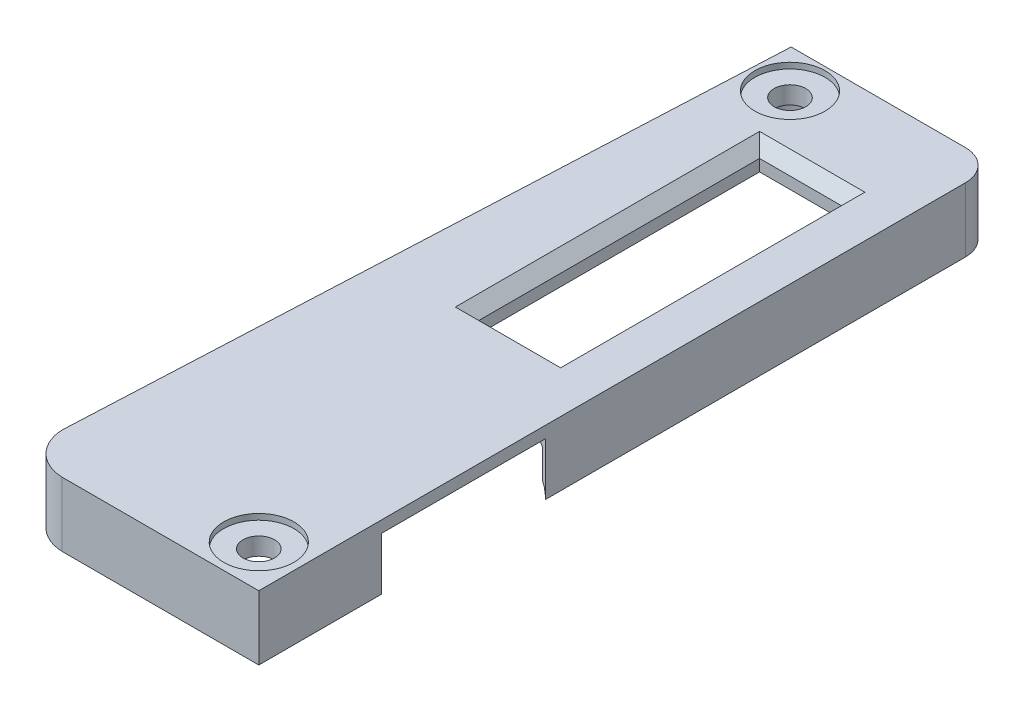
from build123d import *

# Parameters (mm, degrees)
SKETCH_1_R               = 1.35
EXTRUDE_1_DEPTH          = 2
EXTRUDE_2_DEPTH          = 2
CUT_EXTRUDE_1_DEPTH      = 62.421331799
CUT_EXTRUDE_1_DEPTH_BACK = 62.421331799
EXTRUDE_START            = 3.5
EXTRUDE_3_DEPTH          = 3.5
SKETCH_5_W               = 14
SKETCH_5_H               = 4.5
CUT_EXTRUDE_2_DEPTH      = 9
CUT_EXTRUDE_3_REACH      = 63.635
SKETCH_7_W               = 7
SKETCH_7_H               = 24
CUT_EXTRUDE_4_DEPTH      = 62.488454201
CHAMFER_1_SIZE           = 1
EXTRUDE_4_DEPTH          = 3
EXTRUDE_START_2          = 3
EXTRUDE_5_DEPTH          = 3
CHAMFER_2_SIZE           = 1.5
EXTRUDE_6_DEPTH          = 1
EXTRUDE_START_3          = 1
EXTRUDE_7_DEPTH          = 1
SKETCH_12_R              = 3
CUT_EXTRUDE_5_DEPTH      = 0.5


with BuildPart() as part:
    # 草图1 → 凸台-拉伸1 (new body)
    with BuildSketch(Plane(origin=(0, 0, 0), x_dir=(1, 0, 0), z_dir=(0, 1, 0))):
        with BuildLine():
            Line((0, 3.3), (11.7, 3.3))
            ThreePointArc((11.7, 3.3), (13.538477631, 2.538477631), (14.3, 0.7))
            Line((14.3, 0.7), (14.3, -59.7))
            Line((14.3, -59.7), (-3.3, -59.7))
            Line((-3.3, -59.7), (-3.3, 0))
            Line((-3.3, 0), (-3.3, 3.3))
            Line((-3.3, 3.3), (0, 3.3))
        make_face()
        with Locations(Location((0, 0, 0), (0, 0, 270))):
            Circle(SKETCH_1_R, mode=Mode.SUBTRACT)
        with Locations(Location((10.7, -56.1, 0), (0, 0, 270))):
            Circle(SKETCH_1_R, mode=Mode.SUBTRACT)
    extrude(amount=EXTRUDE_1_DEPTH)

    # 草图2 → 凸台-拉伸2 (add)
    with BuildSketch(Plane(origin=(0, 2, 0), x_dir=(1, 0, 0), z_dir=(0, 1, 0))):
        Polygon((-3.3, 1.179910787), (-6.171573065, -59.7), (-3.3, -59.7), align=None)
    extrude(amount=-EXTRUDE_2_DEPTH)

    # 草图3 → 切除-拉伸1 (cut, two sides: drawn at the far end of the back side and taken through both)
    with BuildSketch(Plane(origin=(0, 2, 0), x_dir=(1, 0, 0), z_dir=(0, 1, 0)).offset(-CUT_EXTRUDE_1_DEPTH_BACK)):
        Polygon((-3.3, 3.3), (-3.3, 1.179910787), (-3.2, 3.3), align=None)
        with BuildLine():
            ThreePointArc((-2.499988961, -59.7), (-4.984483511, -58.608076588), (-6.001389, -56.091946))
            Line((-6.001389, -56.091946), (-6.171573065, -59.7))
            Line((-6.171573065, -59.7), (-2.499988961, -59.7))
        make_face()
    extrude(amount=CUT_EXTRUDE_1_DEPTH + CUT_EXTRUDE_1_DEPTH_BACK, mode=Mode.SUBTRACT)

    # 草图4 → 凸台-拉伸3 (add)
    with BuildSketch(Plane.XZ.offset(EXTRUDE_START)):
        with BuildLine():
            Line((-6.001389, 56.091946), (-3.2, -3.3))
            Line((-3.2, -3.3), (11.7, -3.3))
            ThreePointArc((11.7, -3.3), (13.538477631, -2.538477631), (14.3, -0.7))
            Line((14.3, -0.7), (14.3, 59.7))
            Line((14.3, 59.7), (-2.499988961, 59.7))
            ThreePointArc((-2.499988961, 59.7), (-4.984483511, 58.608076588), (-6.001389, 56.091946))
        make_face()
        with BuildLine():
            Line((12.8, -0.7), (12.8, 54.32447191))
            ThreePointArc((12.8, 54.32447191), (12.644543648, 58.044543648), (8.92447191, 58.2))
            Line((8.92447191, 58.2), (-2.476371899, 58.2))
            ThreePointArc((-2.476371899, 58.2), (-3.904150356, 57.567435732), (-4.501255338, 56.124468472))
            Line((-4.501255338, 56.124468472), (-1.945653662, 1.943433001))
            ThreePointArc((-1.945653662, 1.943433001), (-1.872904729, -2.013635488), (2.079062289, -1.8))
            Line((2.079062289, -1.8), (11.7, -1.8))
            ThreePointArc((11.7, -1.8), (12.477817459, -1.477817459), (12.8, -0.7))
        make_face(mode=Mode.SUBTRACT)
    extrude(amount=-EXTRUDE_3_DEPTH)

    # 草图5 → 切除-拉伸2 (cut)
    with BuildSketch(Plane(origin=(14.3, 0, 0), x_dir=(0, 0, -1), z_dir=(1, 0, 0))):
        with Locations((-42.2, -1.25)):
            Rectangle(SKETCH_5_W, SKETCH_5_H)
    extrude(amount=-CUT_EXTRUDE_2_DEPTH, mode=Mode.SUBTRACT)

    # 切除-拉伸3: up to this face of the body (flat: up to its plane)
    cut_extrude_3_end = Plane(part.part.faces().sort_by_distance((9.8, 1, 42.2))[0])
    # 草图6 → 切除-拉伸3 (cut, up to the picked face)
    with BuildSketch(Plane.XZ.offset(3.5), mode=Mode.PRIVATE) as cut_extrude_3_sk1:
        with BuildLine():
            Line((2.158571571, 33.539745962), (2.158571571, 50.860254038))
            ThreePointArc((2.158571571, 50.860254038), (17.158571571, 42.2), (2.158571571, 33.539745962))
        make_face()
    cut_extrude_3_tool1 = split(extrude(cut_extrude_3_sk1.sketch, amount=-CUT_EXTRUDE_3_REACH, mode=Mode.PRIVATE), bisect_by=cut_extrude_3_end, keep=Keep.BOTH, mode=Mode.PRIVATE)
    add(cut_extrude_3_tool1.solids().sort_by(Axis((8.87184, -3.5, 42.2), (0, 1, 0)))[0], mode=Mode.SUBTRACT)

    # 草图7 → 切除-拉伸4 (cut, through all)
    with BuildSketch(Plane.XZ):
        with Locations((6.2, 17.3)):
            Rectangle(SKETCH_7_W, SKETCH_7_H)
    extrude(amount=-CUT_EXTRUDE_4_DEPTH, mode=Mode.SUBTRACT)

    # 倒角1
    chamfer_1_edges = [part.edges().sort_by_distance(p)[0] for p in [
        (2.7, 2, 17.3),
        (6.2, 2, 29.3),
        (9.7, 2, 17.3),
        (6.2, 2, 5.3),
    ]]
    chamfer(chamfer_1_edges, length=CHAMFER_1_SIZE)

    # 草图8 → 凸台-拉伸4 (add)
    with BuildSketch(Plane.XZ):
        Polygon((-2.891678333, 22), (0.3, 22), (0.3, 18), (-2.703007027, 18), align=None)
        Polygon((-2.514335721, 14), (0.3, 14), (0.3, 10), (-2.325664416, 10), align=None)
    extrude(amount=EXTRUDE_4_DEPTH)

    # 草图9 → 凸台-拉伸5 (add)
    with BuildSketch(Plane.XZ.offset(EXTRUDE_START_2)):
        with BuildLine():
            Line((2.75, 0), (2.75, 2.6))
            Line((2.75, 2.6), (3.3, 2.6))
            Line((3.3, 2.6), (3.3, -1.8))
            Line((3.3, -1.8), (2.079062289, -1.8))
            ThreePointArc((2.079062289, -1.8), (2.576812109, -0.960489122), (2.75, 0))
        make_face()
    extrude(amount=-EXTRUDE_5_DEPTH)

    # 倒角2
    chamfer_2_edges = [part.edges().sort_by_distance(p)[0] for p in [
        (0.3, -3, 20),
        (0.3, -3, 12),
        (3.025, -3, 2.6),
    ]]
    chamfer(chamfer_2_edges, length=CHAMFER_2_SIZE)

    # 草图10 → 凸台-拉伸6 (add)
    with BuildSketch(Plane.XZ):
        Polygon((0.3, 22), (0.3, 31.6), (-3.344489466, 31.6), (-2.891678333, 22), align=None)
        Polygon((0.3, 18), (0.3, 14), (-2.514335721, 14), (-2.703007027, 18), align=None)
    extrude(amount=EXTRUDE_6_DEPTH)

    # 草图11 → 凸台-拉伸7 (add)
    with BuildSketch(Plane.XZ.offset(EXTRUDE_START_3)):
        with BuildLine():
            Line((0.3, 31.6), (12.8, 31.6))
            Line((12.8, 31.6), (12.8, 33.943227914))
            ThreePointArc((12.8, 33.943227914), (7.537460775, 32.207180429), (2.158571571, 33.539745962))
            Line((2.158571571, 33.539745962), (2.158571571, 33.6))
            Line((2.158571571, 33.6), (-3.438825119, 33.6))
            Line((-3.438825119, 33.6), (-3.344489466, 31.6))
            Line((-3.344489466, 31.6), (0.3, 31.6))
        make_face()
    extrude(amount=-EXTRUDE_7_DEPTH)

    # 草图12 → 切除-拉伸5 (cut)
    with BuildSketch(Plane(origin=(0, 2, 0), x_dir=(1, 0, 0), z_dir=(0, 1, 0))):
        with Locations(Location((0, 0, 0), (0, 0, 270))):
            Circle(SKETCH_12_R)
        with Locations(Location((10.7, -56.1, 0), (0, 0, 270))):
            Circle(SKETCH_12_R)
    extrude(amount=-CUT_EXTRUDE_5_DEPTH, mode=Mode.SUBTRACT)

    # 倒角3
    # the kernel refuses this chamfer: 0.75 mm, written as the material it takes off along each edge
    with BuildSketch(Plane(origin=(10.7, -3.5, 56.1), x_dir=(-0.7048818539423597, 0, -0.7093247295722755), z_dir=(-0.7093247295722755, 0, 0.7048818539423597))) as chamfer_3_piece_1:
        with BuildLine():
            Line((3.521213203, 0.021213203), (2.728786797, -0.771213203))
            Line((2.728786797, -0.771213203), (2.713786797, -0.771213203))
            ThreePointArc((2.713786797, -0.771213203), (2.735, -0.385606602), (2.735, 0))
            Line((2.735, 0), (2.75, 0.015))
            ThreePointArc((2.75, 0.015), (3.135606602, 0.015), (3.521213203, 0.036213203))
            Line((3.521213203, 0.036213203), (3.521213203, 0.021213203))
        make_face()
    revolve(axis=Axis((10.7, -3.5, 56.1), (0, -1, 0)), revolution_arc=359.64, mode=Mode.SUBTRACT)
    with BuildSketch(Plane(origin=(0, -3.5, 0), x_dir=(0.6787525361233852, 0, 0.7343670708209028), z_dir=(0.7343670708209028, 0, -0.6787525361233852))) as chamfer_3_piece_2:
        with BuildLine():
            Line((2.728786797, -0.771213203), (3.521213203, 0.021213203))
            Line((3.521213203, 0.021213203), (3.521213203, 0.036213203))
            ThreePointArc((3.521213203, 0.036213203), (3.135606602, 0.015), (2.75, 0.015))
            Line((2.75, 0.015), (2.735, 0))
            ThreePointArc((2.735, 0), (2.735, -0.385606602), (2.713786797, -0.771213203))
            Line((2.713786797, -0.771213203), (2.728786797, -0.771213203))
        make_face()
    revolve(axis=Axis((0, -3.5, 0), (0, -1, 0)), revolution_arc=359.64, mode=Mode.SUBTRACT)


solid = part.part
